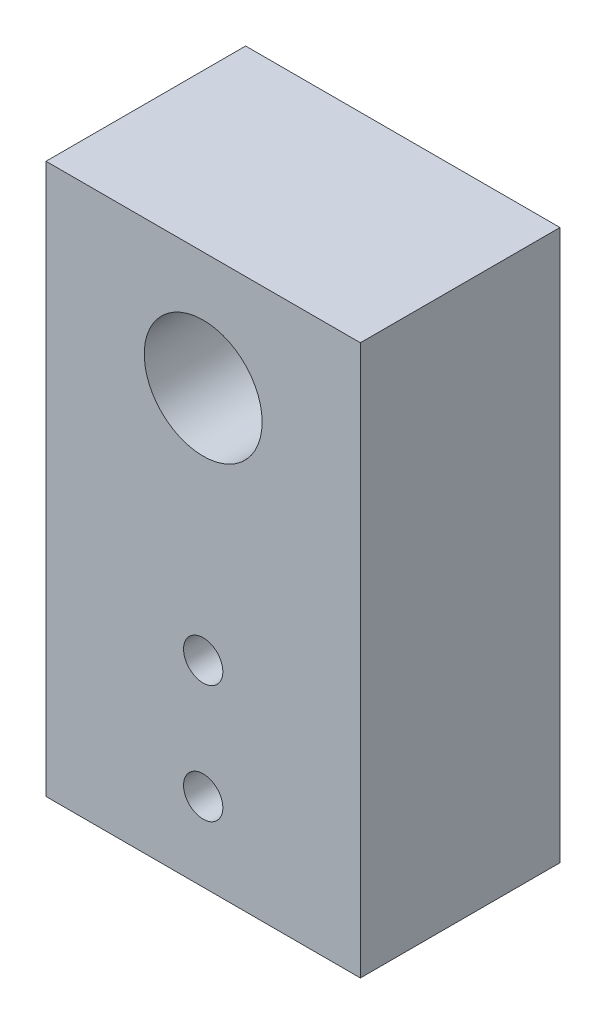
from build123d import *

# Parameters (mm, degrees)
SKETCH1_W           = 40
SKETCH1_H           = 70
SKETCH1_R           = 7.5
SKETCH1_R_2         = 2.5
BOSS_EXTRUDE1_DEPTH = 25.4


with BuildPart() as part:
    # Sketch1 → Boss-Extrude1 (new body)
    with BuildSketch(Plane.XY):
        Rectangle(SKETCH1_W, SKETCH1_H)
        with Locations((0, 20)):
            Circle(SKETCH1_R, mode=Mode.SUBTRACT)
        with Locations((0, -10)):
            Circle(SKETCH1_R_2, mode=Mode.SUBTRACT)
        with Locations((0, -25)):
            Circle(SKETCH1_R_2, mode=Mode.SUBTRACT)
    extrude(amount=BOSS_EXTRUDE1_DEPTH)


solid = part.part
